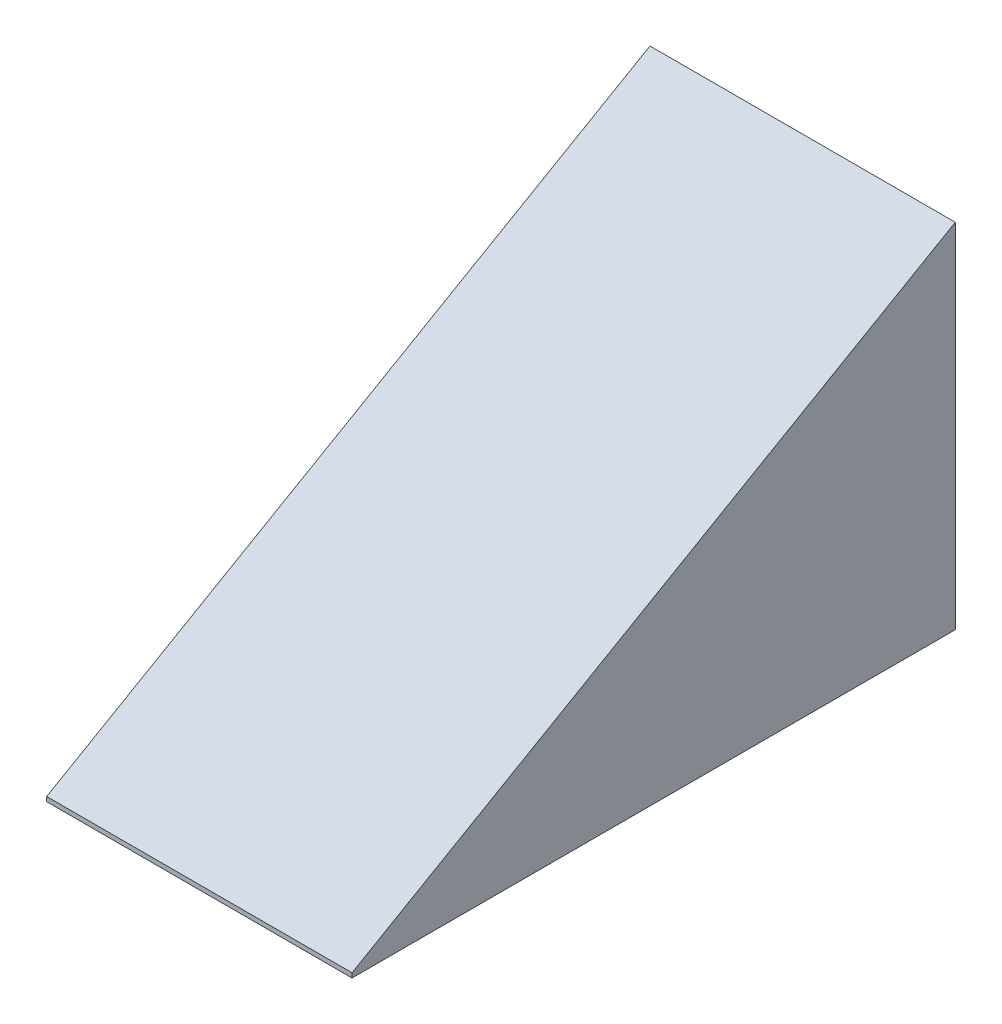
from build123d import *

# Parameters (mm, degrees)
SKETCH1_W           = 88.9
SKETCH1_H           = 152.4
BOSS_EXTRUDE1_DEPTH = 406.4
SHELL1_T            = 3.175
BOSS_EXTRUDE2_DEPTH = 42.8625


with BuildPart() as part:
    # Sketch1 → Boss-Extrude1 (new body)
    with BuildSketch(Plane.XY):
        with Locations((0, 22.86)):
            Rectangle(SKETCH1_W, SKETCH1_H)
    extrude(amount=BOSS_EXTRUDE1_DEPTH)

    # Shell1
    shell1_openings = [part.faces().sort_by_distance(p)[0] for p in [
        (0, 22.86, 0),
        (0, 22.86, 406.4),
    ]]
    offset(amount=SHELL1_T, openings=shell1_openings, kind=Kind.INTERSECTION)


with BuildPart() as body_2:
    # Sketch2 → Boss-Extrude2 (new, symmetric)
    with BuildSketch(Plane(origin=(0, 0, 0), x_dir=(0, 0, -1), z_dir=(1, 0, 0))):
        Polygon((0, 49.53), (0, -49.53), (-169.377248472, -49.53), (-169.377248472, -48.26), align=None)
    extrude(amount=BOSS_EXTRUDE2_DEPTH, both=True)


solid = body_2.part
